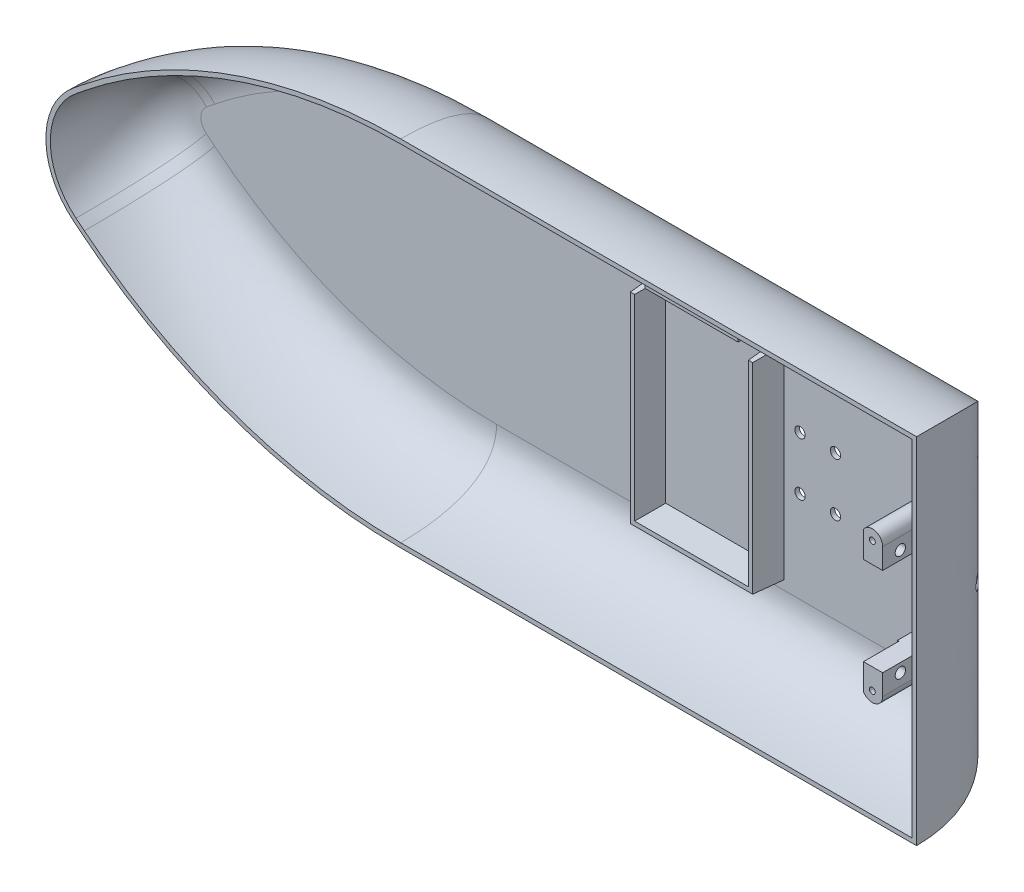
from build123d import *

# Parameters (mm, degrees)
BOSS_EXTRU_1_DEPTH           = 1.5
ENL_V_MAT_EXTRU_1_REACH      = 169.615
ESQUISSE3_R                  = 1.75
BOSS_EXTRU_2_DEPTH           = 10
BOSS_EXTRU_2_DRAFT           = -3
ESQUISSE4_W                  = 32.5
ESQUISSE4_H                  = 2.5
BOSS_EXTRU_2_PROFILE_2_DEPTH = 10
BOSS_EXTRU_2_PROFILE_2_DRAFT = -3
ENL_V_MAT_EXTRU_2_REACH      = 199.538
ESQUISSE8_R                  = 1
BOSS_EXTRU_3_REACH           = 199.538
ESQUISSE9_R                  = 1
ENL_V_MAT_EXTRU_3_DEPTH      = 12
ENL_V_MAT_EXTRU_4_REACH      = 296.441
ESQUISSE11_R                 = 1.75
BOSS_EXTRU_4_REACH           = 295.971
ESQUISSE16_W                 = 15
ESQUISSE16_H                 = 10
ENL_V_MAT_EXTRU_5_REACH      = 358.728
ESQUISSE12_R                 = 2.25
ESQUISSE17_W                 = 4
ESQUISSE17_H                 = 10
ENL_V_MAT_EXTRU_6_DEPTH      = 8


with BuildPart() as part:
    # Esquisse1 → Boss.-Extru.1 (new body)
    with BuildSketch(Plane.XY):
        with BuildLine():
            Line((150.454025839, 73.864865318), (-4.350918075, 73.864865318))
            ThreePointArc((-4.350918075, 73.864865318), (-55.011733191, 65.159871079), (-99.861053968, 40.043471281))
            Line((-99.861053968, 40.043471281), (-102.692538596, 37.750625509))
            ThreePointArc((-102.692538596, 37.750625509), (-104.545974161, 33.864865318), (-102.692538596, 29.979105127))
            Line((-102.692538596, 29.979105127), (-99.861053968, 27.686259355))
            ThreePointArc((-99.861053968, 27.686259355), (-55.011733191, 2.569859558), (-4.350918075, -6.135134682))
            Line((-4.350918075, -6.135134682), (150.454025839, -6.135134682))
            Line((150.454025839, -6.135134682), (150.454025839, 73.864865318))
        make_face()
    extrude(amount=BOSS_EXTRU_1_DEPTH)

    # Esquisse3 → Enlèv. mat.-Extru.1 (cut, up to next)
    with BuildSketch(Plane.XY.offset(1.5), mode=Mode.PRIVATE) as enl_v_mat_extru_1_sk1:
        with Locations((98.454025839, 42.864865318)):
            Circle(ESQUISSE3_R)
    enl_v_mat_extru_1_tool1 = extrude(enl_v_mat_extru_1_sk1.sketch, amount=-ENL_V_MAT_EXTRU_1_REACH, mode=Mode.PRIVATE) & part.part
    # Esquisse3 → Enlèv. mat.-Extru.1 (cut, up to next)
    with BuildSketch(Plane.XY.offset(1.5), mode=Mode.PRIVATE) as enl_v_mat_extru_1_sk2:
        with Locations((98.454025839, 24.864865318)):
            Circle(ESQUISSE3_R)
    enl_v_mat_extru_1_tool2 = extrude(enl_v_mat_extru_1_sk2.sketch, amount=-ENL_V_MAT_EXTRU_1_REACH, mode=Mode.PRIVATE) & part.part
    # Esquisse3 → Enlèv. mat.-Extru.1 (cut, up to next)
    with BuildSketch(Plane.XY.offset(1.5), mode=Mode.PRIVATE) as enl_v_mat_extru_1_sk3:
        with Locations((110.454025839, 24.864865318)):
            Circle(ESQUISSE3_R)
    enl_v_mat_extru_1_tool3 = extrude(enl_v_mat_extru_1_sk3.sketch, amount=-ENL_V_MAT_EXTRU_1_REACH, mode=Mode.PRIVATE) & part.part
    # Esquisse3 → Enlèv. mat.-Extru.1 (cut, up to next)
    with BuildSketch(Plane.XY.offset(1.5), mode=Mode.PRIVATE) as enl_v_mat_extru_1_sk4:
        with Locations((110.454025839, 42.864865318)):
            Circle(ESQUISSE3_R)
    enl_v_mat_extru_1_tool4 = extrude(enl_v_mat_extru_1_sk4.sketch, amount=-ENL_V_MAT_EXTRU_1_REACH, mode=Mode.PRIVATE) & part.part
    add(enl_v_mat_extru_1_tool1.solids().sort_by_distance((98.454026, 42.864865, 1.5))[0], mode=Mode.SUBTRACT)
    add(enl_v_mat_extru_1_tool2.solids().sort_by_distance((98.454026, 24.864865, 1.5))[0], mode=Mode.SUBTRACT)
    add(enl_v_mat_extru_1_tool3.solids().sort_by_distance((110.454026, 24.864865, 1.5))[0], mode=Mode.SUBTRACT)
    add(enl_v_mat_extru_1_tool4.solids().sort_by_distance((110.454026, 42.864865, 1.5))[0], mode=Mode.SUBTRACT)


with BuildPart() as boss_extru_2_tool:
    # Esquisse4 → Boss.-Extru.2 (with draft: the straight prism first)
    with BuildSketch(Plane(origin=(0, 0, 1.5), x_dir=(-1, 0, 0), z_dir=(0, 0, -1))):
        Polygon((-52.954025839, -0.635134682), (-90.454025839, -0.635134682), (-90.454025839, 65.864865318), (-92.954025839, 65.864865318), (-92.954025839, -3.135134682), (-50.454025839, -3.135134682), (-50.454025839, 65.864865318), (-52.954025839, 65.864865318), align=None)
    extrude(amount=-BOSS_EXTRU_2_DEPTH)
    # Boss.-Extru.2: the draft: its side faces are tilted about the plane it starts from
    boss_extru_2_sides = [boss_extru_2_tool.faces().sort_by_distance(p)[0] for p in [
        (71.704025839, -0.635134682, 6.5),
        (90.454025839, 32.614865318, 6.5),
        (91.704025839, 65.864865318, 6.5),
        (92.954025839, 31.364865318, 6.5),
        (71.704025839, -3.135134682, 6.5),
        (50.454025839, 31.364865318, 6.5),
        (51.704025839, 65.864865318, 6.5),
        (52.954025839, 32.614865318, 6.5),
    ]]
    draft(boss_extru_2_sides, Plane(origin=(0, 0, 1.5), x_dir=(-1, 0, 0), z_dir=(0, 0, -1)), BOSS_EXTRU_2_DRAFT)


with BuildPart() as part_1:
    add(part.part)

    # Boss.-Extru.2: add boss_extru_2_tool
    add(boss_extru_2_tool.part)


with BuildPart() as boss_extru_2_profile_2_tool:
    # Esquisse4 → Boss.-Extru.2 profile 2 (with draft: the straight prism first)
    with BuildSketch(Plane(origin=(0, 0, 1.5), x_dir=(-1, 0, 0), z_dir=(0, 0, -1))):
        with Locations((-71.704025839, 69.614865318)):
            Rectangle(ESQUISSE4_W, ESQUISSE4_H)
    extrude(amount=-BOSS_EXTRU_2_PROFILE_2_DEPTH)
    # Boss.-Extru.2 profile 2: the draft: its side faces are tilted about the plane it starts from
    boss_extru_2_profile_2_sides = [boss_extru_2_profile_2_tool.faces().sort_by_distance(p)[0] for p in [
        (55.454025839, 69.614865318, 6.5),
        (71.704025839, 70.864865318, 6.5),
        (87.954025839, 69.614865318, 6.5),
        (71.704025839, 68.364865318, 6.5),
    ]]
    draft(boss_extru_2_profile_2_sides, Plane(origin=(0, 0, 1.5), x_dir=(-1, 0, 0), z_dir=(0, 0, -1)), BOSS_EXTRU_2_PROFILE_2_DRAFT)


with BuildPart() as part_2:
    add(part_1.part)

    # Boss.-Extru.2 profile 2: add boss_extru_2_profile_2_tool
    add(boss_extru_2_profile_2_tool.part)

    # Balayage1: sweep along a path in Esquisse1<2>
    with BuildLine(Plane.XY) as balayage1_path:
        Line((150.454025839, 73.864865318), (-4.350918075, 73.864865318))
        ThreePointArc((-4.350918075, 73.864865318), (-55.011733191, 65.159871079), (-99.861053968, 40.043471281))
        Line((-99.861053968, 40.043471281), (-102.692538596, 37.750625509))
        ThreePointArc((-102.692538596, 37.750625509), (-104.545974161, 33.864865318), (-102.692538596, 29.979105127))
        Line((-102.692538596, 29.979105127), (-99.861053968, 27.686259355))
        ThreePointArc((-99.861053968, 27.686259355), (-55.011733191, 2.569859558), (-4.350918075, -6.135134682))
        Line((-4.350918075, -6.135134682), (150.454025839, -6.135134682))
        Line((150.454025839, -6.135134682), (150.454025839, 73.864865318))
    # Esquisse7 → Balayage1 (sweep)
    with BuildSketch(Plane(origin=(150.454025839, 0, 0), x_dir=(0, 0, -1), z_dir=(1, 0, 0))):
        with BuildLine():
            Line((-1.5, 73.864865318), (0, 73.864865318))
            add(Edge.make_bspline(
                [(0, 73.864865318), (0, 79.772226213), (-3.099638508, 93.803150825), (-34, 93.864865318)],
                knots=[0, 0, 0, 0, 1, 1, 1, 1], degree=3))
            Line((-34, 93.864865318), (-34, 92.364865318))
            add(Edge.make_bspline(
                [(-34, 92.364865318), (-30.824934583, 92.364865318), (-1.5, 92.909703572), (-1.5, 73.864865318)],
                knots=[0, 0, 0, 0, 1, 1, 1, 1], degree=3))
        make_face()
    sweep(path=balayage1_path.line, transition=Transition.RIGHT)

    # Esquisse8 → Enlèv. mat.-Extru.2 (cut, up to next)
    with BuildSketch(Plane(origin=(0, 0, 0), x_dir=(-1, 0, 0), z_dir=(0, 0, -1)), mode=Mode.PRIVATE) as enl_v_mat_extru_2_sk1:
        with Locations((-155.454025839, 55.864865318)):
            Circle(ESQUISSE8_R)
    enl_v_mat_extru_2_tool1 = extrude(enl_v_mat_extru_2_sk1.sketch, amount=-ENL_V_MAT_EXTRU_2_REACH, mode=Mode.PRIVATE) & part_2.part
    # Esquisse8 → Enlèv. mat.-Extru.2 (cut, up to next)
    with BuildSketch(Plane(origin=(0, 0, 0), x_dir=(-1, 0, 0), z_dir=(0, 0, -1)), mode=Mode.PRIVATE) as enl_v_mat_extru_2_sk2:
        with Locations((-155.454025839, 11.864865318)):
            Circle(ESQUISSE8_R)
    enl_v_mat_extru_2_tool2 = extrude(enl_v_mat_extru_2_sk2.sketch, amount=-ENL_V_MAT_EXTRU_2_REACH, mode=Mode.PRIVATE) & part_2.part
    add(enl_v_mat_extru_2_tool1.solids().sort_by_distance((155.454026, 55.864865, 0))[0], mode=Mode.SUBTRACT)
    add(enl_v_mat_extru_2_tool2.solids().sort_by_distance((155.454026, 11.864865, 0))[0], mode=Mode.SUBTRACT)

    # Esquisse9 → Boss.-Extru.3 (add, up to next)
    with BuildSketch(Plane.XY.offset(34), mode=Mode.PRIVATE) as boss_extru_3_sk1:
        with BuildLine():
            Line((151.954025839, 55.864865318), (151.954025839, 48.864865318))
            Line((151.954025839, 48.864865318), (158.954025839, 48.864865318))
            Line((158.954025839, 48.864865318), (158.954025839, 55.864865318))
            ThreePointArc((158.954025839, 55.864865318), (155.454025839, 59.364865318), (151.954025839, 55.864865318))
        make_face()
        with Locations((155.454025839, 55.864865318)):
            Circle(ESQUISSE9_R, mode=Mode.SUBTRACT)
    boss_extru_3_tool1 = extrude(boss_extru_3_sk1.sketch, amount=-BOSS_EXTRU_3_REACH, mode=Mode.PRIVATE) - part_2.part
    # Esquisse9 → Boss.-Extru.3 (add, up to next)
    with BuildSketch(Plane.XY.offset(34), mode=Mode.PRIVATE) as boss_extru_3_sk2:
        with BuildLine():
            Line((158.954025839, 11.864865318), (158.954025839, 18.864865318))
            Line((158.954025839, 18.864865318), (151.954025839, 18.864865318))
            Line((151.954025839, 18.864865318), (151.954025839, 11.864865318))
            ThreePointArc((151.954025839, 11.864865318), (155.454025839, 8.364865318), (158.954025839, 11.864865318))
        make_face()
        with Locations((155.454025839, 11.864865318)):
            Circle(ESQUISSE9_R, mode=Mode.SUBTRACT)
    boss_extru_3_tool2 = extrude(boss_extru_3_sk2.sketch, amount=-BOSS_EXTRU_3_REACH, mode=Mode.PRIVATE) - part_2.part
    add(boss_extru_3_tool1.solids().sort_by_distance((155.454026, 53.669547, 34))[0])
    add(boss_extru_3_tool2.solids().sort_by_distance((155.454026, 14.060183, 34))[0])

    # Esquisse10 → Enlèv. mat.-Extru.3 (cut)
    with BuildSketch(Plane.XY.offset(34)):
        with BuildLine():
            Line((152.454025839, 10.06208968), (152.454025839, 18.864865318))
            Line((152.454025839, 18.864865318), (151.954025839, 18.864865318))
            Line((151.954025839, 18.864865318), (151.954025839, 11.864865318))
            ThreePointArc((151.954025839, 11.864865318), (152.081341448, 10.929450971), (152.454025839, 10.06208968))
        make_face()
        with BuildLine():
            Line((152.454025839, 48.864865318), (152.454025839, 57.667640956))
            ThreePointArc((152.454025839, 57.667640956), (152.081341448, 56.800279665), (151.954025839, 55.864865318))
            Line((151.954025839, 55.864865318), (151.954025839, 48.864865318))
            Line((151.954025839, 48.864865318), (152.454025839, 48.864865318))
        make_face()
    extrude(amount=-ENL_V_MAT_EXTRU_3_DEPTH, mode=Mode.SUBTRACT)

    # Esquisse11 → Enlèv. mat.-Extru.4 (cut, up to next)
    with BuildSketch(Plane.ZY.offset(-152.454025839), mode=Mode.PRIVATE) as enl_v_mat_extru_4_sk1:
        with Locations((28, 51.864865318)):
            Circle(ESQUISSE11_R)
    enl_v_mat_extru_4_tool1 = extrude(enl_v_mat_extru_4_sk1.sketch, amount=-ENL_V_MAT_EXTRU_4_REACH, mode=Mode.PRIVATE) & part_2.part
    # Esquisse11 → Enlèv. mat.-Extru.4 (cut, up to next)
    with BuildSketch(Plane.ZY.offset(-152.454025839), mode=Mode.PRIVATE) as enl_v_mat_extru_4_sk2:
        with Locations((28, 15.864865318)):
            Circle(ESQUISSE11_R)
    enl_v_mat_extru_4_tool2 = extrude(enl_v_mat_extru_4_sk2.sketch, amount=-ENL_V_MAT_EXTRU_4_REACH, mode=Mode.PRIVATE) & part_2.part
    add(enl_v_mat_extru_4_tool1.solids().sort_by_distance((152.454026, 51.864865, 28))[0], mode=Mode.SUBTRACT)
    add(enl_v_mat_extru_4_tool2.solids().sort_by_distance((152.454026, 15.864865, 28))[0], mode=Mode.SUBTRACT)

    # Esquisse16 → Boss.-Extru.4 (add, up to next)
    with BuildSketch(Plane.ZY.offset(-151.954025839), mode=Mode.PRIVATE) as boss_extru_4_sk1:
        with Locations((9.063025814, 33.864865318)):
            Rectangle(ESQUISSE16_W, ESQUISSE16_H)
    boss_extru_4_tool1 = extrude(boss_extru_4_sk1.sketch, amount=-BOSS_EXTRU_4_REACH, mode=Mode.PRIVATE) - part_2.part
    add(boss_extru_4_tool1.solids().sort_by_distance((151.954026, 33.864865, 9.063026))[0])

    # Enlèv. mat.-Extru.5: up to this plane
    enl_v_mat_extru_5_end = Plane(origin=(151.954025839, 0, 0), z_dir=(-1, 0, 0))
    # Esquisse12 → Enlèv. mat.-Extru.5 (cut, up to the surface)
    with BuildSketch(Plane(origin=(202.342576717, 0, -73.64667505), x_dir=(-0.34202014332566427, 0, -0.93969262078591), z_dir=(0.93969262078591, -1.2457869471927707e-15, -0.34202014332566427)), mode=Mode.PRIVATE) as enl_v_mat_extru_5_sk1:
        with Locations((-61.752546666, 33.864865318)):
            Circle(ESQUISSE12_R)
    enl_v_mat_extru_5_tool1 = split(extrude(enl_v_mat_extru_5_sk1.sketch, amount=-ENL_V_MAT_EXTRU_5_REACH, mode=Mode.PRIVATE), bisect_by=enl_v_mat_extru_5_end, keep=Keep.BOTH, mode=Mode.PRIVATE)
    add(enl_v_mat_extru_5_tool1.solids().sort_by_distance((223.463192, 33.864865, -15.618263))[0], mode=Mode.SUBTRACT)

    # Esquisse17 → Enlèv. mat.-Extru.6 (cut)
    with BuildSketch(Plane.XY.offset(16.563025814)):
        with Locations((158.954025839, 33.864865318)):
            Rectangle(ESQUISSE17_W, ESQUISSE17_H)
    extrude(amount=-ENL_V_MAT_EXTRU_6_DEPTH, mode=Mode.SUBTRACT)


solid = part_2.part
